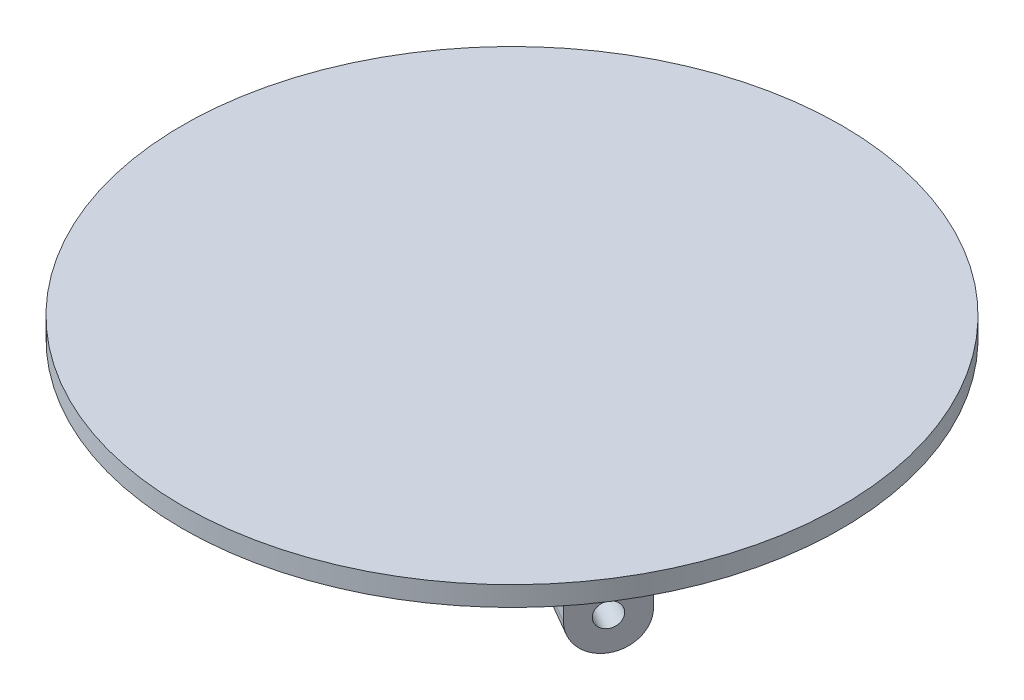
from build123d import *

# Parameters (mm, degrees)
BOSS_EXTRUDE1_DEPTH     = 17
CUT_EXTRUDE1_REACH      = 46.598
SKETCH3_W               = 35
SKETCH3_H               = 14
FILLET1_R               = 5
M3_CLEARANCE_HOLE1_D    = 3.6
CIRPATTERN1_START       = 14
CIRPATTERN1_DEPTH       = 3
CIRPATTERN1_START_2     = 6.8000001
CIRPATTERN1_2_DEPTH     = 7.1999999
CIRPATTERN1_3_DEPTH     = 6.8000001
CIRPATTERN1_START_3     = -40
CIRPATTERN1_4_OUTLINE_R = 1.8
CIRPATTERN1_4_DEPTH     = 5
CIRPATTERN1_START_4     = 35
CIRPATTERN1_5_OUTLINE_R = 1.8
CIRPATTERN1_5_DEPTH     = 5
SKETCH6_R               = 50
BOSS_EXTRUDE2_DEPTH     = 3
FILLET6_R               = 2


with BuildPart() as part:
    # Sketch2 → Boss-Extrude1 (new body)
    with BuildSketch(Plane(origin=(0, 0, 0), x_dir=(1, 0, 0), z_dir=(0, 1, 0))):
        Polygon((0, 0), (-5, 2.886751346), (-5, 40), (5, 40), (5, 2.886751346), align=None)
    extrude(amount=BOSS_EXTRUDE1_DEPTH)

    # Sketch3 → Cut-Extrude1 (cut, up to next)
    with BuildSketch(Plane(origin=(5, 0, 0), x_dir=(0, 0, -1), z_dir=(1, 0, 0)), mode=Mode.PRIVATE) as cut_extrude1_sk1:
        with Locations((17.5, 7)):
            Rectangle(SKETCH3_W, SKETCH3_H)
    cut_extrude1_tool1 = extrude(cut_extrude1_sk1.sketch, amount=-CUT_EXTRUDE1_REACH, mode=Mode.PRIVATE) & part.part
    add(cut_extrude1_tool1.solids().sort_by_distance((5, 7, -17.5))[0], mode=Mode.SUBTRACT)

    # Fillet1
    fillet1_edges = [part.edges().sort_by_distance(p)[0] for p in [
        (-5, 0, -37.5),
        (5, 0, -37.5),
    ]]
    fillet(fillet1_edges, radius=FILLET1_R - 0.0001)  # a hair under: the kernel refuses the full size

    # M3 Clearance Hole1 (through all)
    with Locations(Plane(origin=(0, 0, -40), x_dir=(-1, 0, 0), z_dir=(0, 0, -1))):
        with Locations((0, 5)):
            Hole(M3_CLEARANCE_HOLE1_D / 2)

    # CirPattern1: read off the stored shape, not the designer's step
    # CirPattern1 outline → CirPattern1 (add)
    with BuildSketch(Plane(origin=(0, 0, 0), x_dir=(1, 0, 0), z_dir=(0, 1, 0)).offset(CIRPATTERN1_START)):
        Polygon((-37.141016151, -15.669872981), (-32.141016151, -24.330127019), (0, -5.773502692), (32.141016151, -24.330127019), (37.141016151, -15.669872981), (5, 2.886751346), (0, 0), (-5, 2.886751346), align=None)
    extrude(amount=CIRPATTERN1_DEPTH)

    # CirPattern1 2 outline → CirPattern1 2 (add)
    with BuildSketch(Plane(origin=(0, 0, 0), x_dir=(1, 0, 0), z_dir=(0, 1, 0)).offset(CIRPATTERN1_START_2)):
        Polygon((-32.810889132, -13.169872981), (-37.141016151, -15.669872981), (-32.141016151, -24.330127019), (-27.810889132, -21.830127019), align=None)
        Polygon((32.810889132, -13.169872981), (27.810889132, -21.830127019), (32.141016151, -24.330127019), (37.141016151, -15.669872981), align=None)
    extrude(amount=CIRPATTERN1_2_DEPTH)

    # CirPattern1 3 outline → CirPattern1 3 (add)
    with BuildSketch(Plane(origin=(0, 0, 0), x_dir=(1, 0, 0), z_dir=(0, 1, 0))):
        Polygon((32.810889132, -13.169872981), (27.810889132, -21.830127019), (32.141016151, -24.330127019), (37.141016151, -15.669872981), align=None)
        Polygon((-32.810889132, -13.169872981), (-37.141016151, -15.669872981), (-32.141016151, -24.330127019), (-27.810889132, -21.830127019), align=None)
    extrude(amount=CIRPATTERN1_3_DEPTH)

    # CirPattern1 4 outline → CirPattern1 4 (cut)
    with BuildSketch(Plane(origin=(0, 0, 0), x_dir=(0.500000000000006, 0, 0.8660254037844353), z_dir=(0.8660254037844352, 0, -0.5000000000000061)).offset(CIRPATTERN1_START_3)):
        with BuildLine():
            Line((5, 0), (0, 0))
            ThreePointArc((0, 0), (3.535533906, -1.464466094), (5, -5))
            Line((5, -5), (5, 0))
        make_face()
        with BuildLine():
            ThreePointArc((-5, -5), (-3.535533906, -1.464466094), (0, 0))
            Line((0, 0), (-5, 0))
            Line((-5, 0), (-5, -5))
        make_face()
        with Locations((0, -5)):
            Circle(CIRPATTERN1_4_OUTLINE_R)
    extrude(amount=CIRPATTERN1_4_DEPTH, mode=Mode.SUBTRACT)

    # CirPattern1 5 outline → CirPattern1 5 (cut)
    with BuildSketch(Plane(origin=(0, 0, 0), x_dir=(0.4999999999999894, 0, -0.8660254037844448), z_dir=(0.8660254037844447, 0, 0.4999999999999898)).offset(CIRPATTERN1_START_4)):
        with BuildLine():
            Line((-5, 0), (0, 0))
            ThreePointArc((0, 0), (-3.535533906, 1.464466094), (-5, 5))
            Line((-5, 5), (-5, 0))
        make_face()
        with BuildLine():
            ThreePointArc((5, 5), (3.535533906, 1.464466094), (0, 0))
            Line((0, 0), (5, 0))
            Line((5, 0), (5, 5))
        make_face()
        with Locations((0, 5)):
            Circle(CIRPATTERN1_5_OUTLINE_R)
    extrude(amount=CIRPATTERN1_5_DEPTH, mode=Mode.SUBTRACT)

    # Sketch6 → Boss-Extrude2 (add)
    with BuildSketch(Plane(origin=(0, 14, 0), x_dir=(1, 0, 0), z_dir=(0, 1, 0))):
        with Locations(Location((0, 0, 0), (0, 0, 90))):
            Circle(SKETCH6_R)
    extrude(amount=BOSS_EXTRUDE2_DEPTH)

    # Fillet6
    fillet6_edges = [part.edges().sort_by_distance(p)[0] for p in [
        (5, 14, -37.5),
        (0, 14, -40),
        (-5, 14, -37.5),
        (-34.975952642, 14, 14.419872981),
        (-34.641016151, 14, 20),
        (-29.975952642, 14, 23.080127019),
        (29.975952642, 14, 23.080127019),
        (34.641016151, 14, 20),
        (34.975952642, 14, 14.419872981),
        (0, 14, -35),
        (-30.310889132, 14, 17.5),
        (30.310889132, 14, 17.5),
    ]]
    fillet(fillet6_edges, radius=FILLET6_R)


solid = part.part
